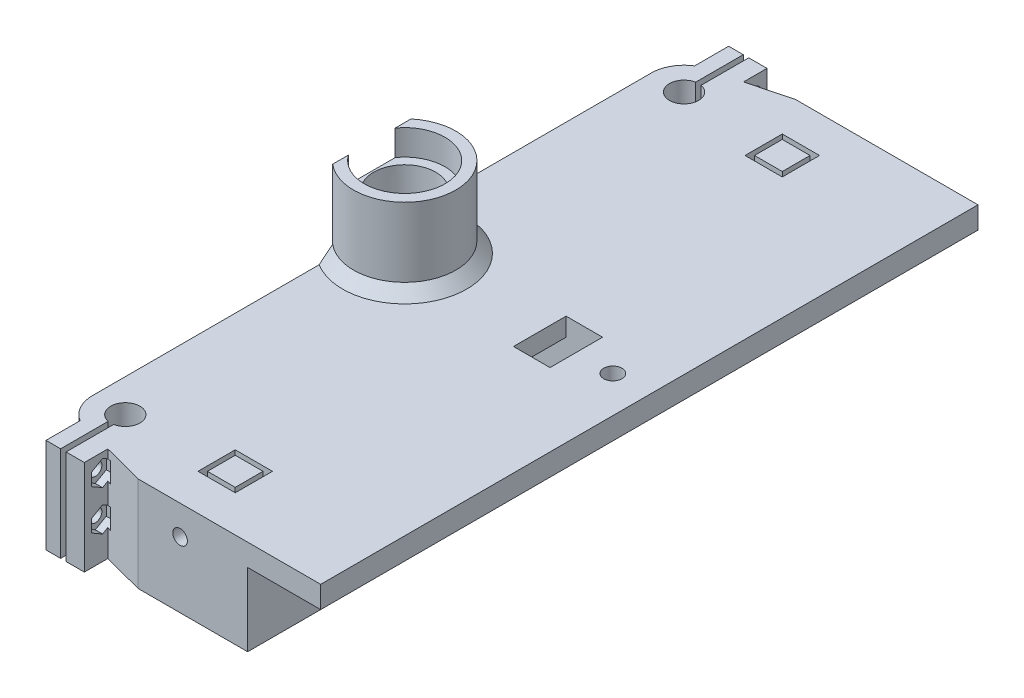
from build123d import *

# Parameters (mm, degrees)
SZKIC1_W                         = 20
SZKIC1_H                         = 6
DODANIE_WYCI_GNI_CIE1_DEPTH      = 180
SZKIC2_R                         = 4
DODANIE_WYCI_GNI_CIE2_DEPTH      = 26
WYTNIJ_WYCI_GNI_CIE5_START       = -21
WYTNIJ_WYCI_GNI_CIE5_OUTLINE_R   = 4
WYTNIJ_WYCI_GNI_CIE5_DEPTH       = 21
SZKIC8_W                         = 13
SZKIC8_H                         = 9
SZKIC8_R                         = 2
WYTNIJ_WYCI_GNI_CIE6_DEPTH       = 4
DODANIE_WYCI_GNI_CIE4_START      = 22
SZKIC9_R                         = 14
SZKIC9_R_2                       = 4
DODANIE_WYCI_GNI_CIE4_DEPTH      = 22
SZKIC10_R                        = 11.05
SZKIC10_R_2                      = 4
WYTNIJ_WYCI_GNI_CIE7_DEPTH       = 7
SZKIC11_R                        = 8
SZKIC11_R_2                      = 4
WYTNIJ_WYCI_GNI_CIE8_DEPTH       = 15
SFAZOWANIE1_SIZE                 = 0.5
SFAZOWANIE1_SIZE2                = 12
WYTNIJ_WYCI_GNI_CIE9_START       = 22
WYTNIJ_WYCI_GNI_CIE9_DEPTH       = 22
WYTNIJ_WYCI_GNI_CIE10_START      = -3
SZKIC13_R                        = 4
WYTNIJ_WYCI_GNI_CIE10_DEPTH      = 3
SZKIC14_R                        = 2
WYTNIJ_WYCI_GNI_CIE11_DEPTH      = 8
WYTNIJ_WYCI_GNI_CIE12_START      = -26
SZKIC15_R                        = 2.8
WYTNIJ_WYCI_GNI_CIE12_DEPTH      = 10
SFAZOWANIE2_SIZE                 = 3
SZKIC16_W                        = 10.2
SZKIC16_H                        = 10.2
SZKIC16_W_2                      = 7.6
SZKIC16_H_2                      = 7.6
WYTNIJ_WYCI_GNI_CIE13_DEPTH      = 17
WYTNIJ_WYCI_GNI_CIE14_DEPTH      = 10
WYTNIJ_WYCI_GNI_CIE14_DEPTH_BACK = 8
SZKIC17_R                        = 2.5
SZKIC17_W                        = 10
SZKIC17_H                        = 14.4
WYTNIJ_WYCI_GNI_CIE15_DEPTH      = 194.473512399
DODANIE_WYCI_GNI_CIE5_DEPTH      = 26
WYTNIJ_WYCI_GNI_CIE16_REACH      = 197.51
SZKIC20_R                        = 1.8
WYTNIJ_WYCI_GNI_CIE17_START      = -11.5
WYTNIJ_WYCI_GNI_CIE17_DEPTH      = 3
DODANIE_WYCI_GNI_CIE6_START      = -2
DODANIE_WYCI_GNI_CIE6_DEPTH      = 2
SZKIC23_R                        = 2
WYTNIJ_WYCI_GNI_CIE18_DEPTH      = 10


# Read off the part's stored shape, not the designer's step: Wytnij-wyciągnięcie5
with BuildPart() as part:
    # Szkic1 → Dodanie-wyciągnięcie1 (new body)
    with BuildSketch(Plane.XY):
        Polygon((-10, -26), (-10, -6), (-10, 0), (-40, 0), (-40, -26), align=None)
        with Locations((0, -3)):
            Rectangle(SZKIC1_W, SZKIC1_H)
    extrude(amount=DODANIE_WYCI_GNI_CIE1_DEPTH)

    # Szkic2 → Dodanie-wyciągnięcie2 (add)
    with BuildSketch(Plane(origin=(0, 0, 0), x_dir=(1, 0, 0), z_dir=(0, 1, 0))):
        with BuildLine():
            Line((-40, -180), (-40, 0))
            Line((-40, 0), (-57, -4.5))
            ThreePointArc((-57, -4.5), (-63.363961031, -7.136038969), (-66, -13.5))
            Line((-66, -13.5), (-66, -166.5))
            ThreePointArc((-66, -166.5), (-63.363961031, -172.863961031), (-57, -175.5))
            Line((-57, -175.5), (-40, -180))
        make_face()
        with Locations(Location((-57, -90, 0), (0, 0, 180))):
            Circle(SZKIC2_R, mode=Mode.SUBTRACT)
        with Locations(Location((-57, -13.5, 0), (0, 0, 180))):
            Circle(SZKIC2_R, mode=Mode.SUBTRACT)
        with Locations(Location((-57, -166.5, 0), (0, 0, 180))):
            Circle(SZKIC2_R, mode=Mode.SUBTRACT)
    extrude(amount=-DODANIE_WYCI_GNI_CIE2_DEPTH)

    # Wytnij-wyciągnięcie5 outline → Wytnij-wyciągnięcie5 (cut)
    with BuildSketch(Plane.XZ.offset(26).offset(WYTNIJ_WYCI_GNI_CIE5_START)):
        with BuildLine():
            ThreePointArc((-63, 85.8), (-62.121320344, 83.678679656), (-60, 82.8))
            Line((-60, 82.8), (-57.7, 82.8))
            ThreePointArc((-57.7, 82.8), (-51.7, 76.8), (-45.7, 82.8))
            Line((-45.7, 82.8), (-10, 82.8))
            Line((-10, 82.8), (-10, 97.2))
            Line((-10, 97.2), (-45.7, 97.2))
            ThreePointArc((-45.7, 97.2), (-51.7, 103.2), (-57.7, 97.2))
            Line((-57.7, 97.2), (-60, 97.2))
            ThreePointArc((-60, 97.2), (-62.121320344, 96.321320344), (-63, 94.2))
            Line((-63, 94.2), (-63, 85.8))
        make_face()
        with Locations((-57, 90)):
            Circle(WYTNIJ_WYCI_GNI_CIE5_OUTLINE_R, mode=Mode.SUBTRACT)
    extrude(amount=WYTNIJ_WYCI_GNI_CIE5_DEPTH, mode=Mode.SUBTRACT)

    # Szkic8 → Wytnij-wyciągnięcie6 (cut)
    with BuildSketch(Plane.XZ.offset(5)):
        with Locations((-41.7, 90)):
            Rectangle(SZKIC8_W, SZKIC8_H)
        with Locations(Location((-51.7, 97.2, 0), (0, 0, 270))):
            Circle(SZKIC8_R)
        with Locations(Location((-51.7, 82.8, 0), (0, 0, 270))):
            Circle(SZKIC8_R)
    extrude(amount=-WYTNIJ_WYCI_GNI_CIE6_DEPTH, mode=Mode.SUBTRACT)

    # Szkic9 → Dodanie-wyciągnięcie4 (add)
    with BuildSketch(Plane(origin=(0, 0, 0), x_dir=(1, 0, 0), z_dir=(0, 1, 0)).offset(DODANIE_WYCI_GNI_CIE4_START)):
        with Locations(Location((-57, -90, 0), (0, 0, 229.994799115))):
            Circle(SZKIC9_R)
        with Locations(Location((-57, -90, 0), (0, 0, 180))):
            Circle(SZKIC9_R_2, mode=Mode.SUBTRACT)
    extrude(amount=-DODANIE_WYCI_GNI_CIE4_DEPTH)

    # Szkic10 → Wytnij-wyciągnięcie7 (cut)
    with BuildSketch(Plane(origin=(0, 22, 0), x_dir=(1, 0, 0), z_dir=(0, 1, 0))):
        with Locations(Location((-57, -90, 0), (0, 0, 180))):
            Circle(SZKIC10_R)
        with Locations(Location((-57, -90, 0), (0, 0, 180))):
            Circle(SZKIC10_R_2, mode=Mode.SUBTRACT)
    extrude(amount=-WYTNIJ_WYCI_GNI_CIE7_DEPTH, mode=Mode.SUBTRACT)

    # Szkic11 → Wytnij-wyciągnięcie8 (cut)
    with BuildSketch(Plane(origin=(0, 15, 0), x_dir=(1, 0, 0), z_dir=(0, 1, 0))):
        with Locations(Location((-57, -90, 0), (0, 0, 180))):
            Circle(SZKIC11_R)
        with Locations(Location((-57, -90, 0), (0, 0, 180))):
            Circle(SZKIC11_R_2, mode=Mode.SUBTRACT)
    extrude(amount=-WYTNIJ_WYCI_GNI_CIE8_DEPTH, mode=Mode.SUBTRACT)

    # Sfazowanie1
    sfazowanie1_edges = [part.edges().sort_by_distance(p)[0] for p in [
        (-49, 15, 90),
    ]]
    sfazowanie1_side = [part.faces().sort_by_distance(p)[0] for p in [
        (-46.262541197, 15, 90),
    ]]
    chamfer(sfazowanie1_edges, length=SFAZOWANIE1_SIZE, length2=SFAZOWANIE1_SIZE2, reference=sfazowanie1_side[0])

    # Szkic12 → Wytnij-wyciągnięcie9 (cut)
    with BuildSketch(Plane(origin=(0, 0, 0), x_dir=(1, 0, 0), z_dir=(0, 1, 0)).offset(WYTNIJ_WYCI_GNI_CIE9_START)):
        with BuildLine():
            Line((-66, -100.723805295), (-66, -79.276194705))
            ThreePointArc((-66, -79.276194705), (-71, -90), (-66, -100.723805295))
        make_face()
    extrude(amount=-WYTNIJ_WYCI_GNI_CIE9_DEPTH, mode=Mode.SUBTRACT)

    # Szkic13 → Wytnij-wyciągnięcie10 (cut)
    with BuildSketch(Plane.XZ.offset(26).offset(WYTNIJ_WYCI_GNI_CIE10_START)):
        with BuildLine():
            Line((-60, 104.2), (-30, 104.2))
            ThreePointArc((-30, 104.2), (-26.464466094, 102.735533906), (-25, 99.2))
            Line((-25, 99.2), (-25, 80.8))
            ThreePointArc((-25, 80.8), (-26.464466094, 77.264466094), (-30, 75.8))
            Line((-30, 75.8), (-60, 75.8))
            ThreePointArc((-60, 75.8), (-63.535533906, 77.264466094), (-65, 80.8))
            Line((-65, 80.8), (-65, 99.2))
            ThreePointArc((-65, 99.2), (-63.535533906, 102.735533906), (-60, 104.2))
        make_face()
        with Locations(Location((-57, 90, 0), (0, 0, 180))):
            Circle(SZKIC13_R, mode=Mode.SUBTRACT)
    extrude(amount=WYTNIJ_WYCI_GNI_CIE10_DEPTH, mode=Mode.SUBTRACT)

    # Szkic14 → Wytnij-wyciągnięcie11 (cut)
    with BuildSketch(Plane.XZ.offset(23)):
        with Locations(Location((-60, 101.2, 0), (0, 0, 270))):
            Circle(SZKIC14_R)
        with Locations(Location((-30, 101.2, 0), (0, 0, 270))):
            Circle(SZKIC14_R)
        with Locations(Location((-30, 78.8, 0), (0, 0, 270))):
            Circle(SZKIC14_R)
        with Locations(Location((-60, 78.8, 0), (0, 0, 270))):
            Circle(SZKIC14_R)
    extrude(amount=-WYTNIJ_WYCI_GNI_CIE11_DEPTH, mode=Mode.SUBTRACT)

    # Szkic15 → Wytnij-wyciągnięcie12 (cut)
    with BuildSketch(Plane(origin=(0, 0, 0), x_dir=(1, 0, 0), z_dir=(0, 1, 0)).offset(WYTNIJ_WYCI_GNI_CIE12_START)):
        with Locations((-15, -160)):
            Circle(SZKIC15_R)
        with Locations((-20, -103)):
            Circle(SZKIC15_R)
        with Locations((-15, -20)):
            Circle(SZKIC15_R)
        with Locations((-20, -77)):
            Circle(SZKIC15_R)
        Polygon((10, 0), (-10, 0), (-10, -82.8), (-10, -97.2), (-10, -180), (10, -180), align=None)
    extrude(amount=WYTNIJ_WYCI_GNI_CIE12_DEPTH, mode=Mode.SUBTRACT)

    # Sfazowanie2
    sfazowanie2_edges = [part.edges().sort_by_distance(p)[0] for p in [
        (-43, 0, 90),
    ]]
    chamfer(sfazowanie2_edges, length=SFAZOWANIE2_SIZE)

    # Szkic16 → Wytnij-wyciągnięcie13 (cut)
    with BuildSketch(Plane(origin=(0, 0, 0), x_dir=(1, 0, 0), z_dir=(0, 1, 0))):
        with Locations((-28.5, -164.9)):
            Rectangle(SZKIC16_W, SZKIC16_H)
        with Locations((-28.5, -164.9)):
            Rectangle(SZKIC16_W_2, SZKIC16_H_2, mode=Mode.SUBTRACT)
    wytnij_wyci_gni_cie13 = extrude(amount=-WYTNIJ_WYCI_GNI_CIE13_DEPTH, mode=Mode.SUBTRACT)

    # Lustro2: Wytnij-wyciągnięcie13 across plane
    add(wytnij_wyci_gni_cie13.mirror(Plane(origin=(0, 0, 90), x_dir=(1, 0, 0), z_dir=(0, 0, -1))), mode=Mode.SUBTRACT)

    # Szkic17 → Wytnij-wyciągnięcie14 (cut, two sides: drawn at the far end of the back side and taken through both)
    with BuildSketch(Plane.XZ.offset(5).offset(-WYTNIJ_WYCI_GNI_CIE14_DEPTH_BACK)):
        with Locations(Location((0, 90, 0), (0, 0, 90))):
            Circle(SZKIC17_R)
        with Locations((-15, 90)):
            Rectangle(SZKIC17_W, SZKIC17_H)
    extrude(amount=WYTNIJ_WYCI_GNI_CIE14_DEPTH + WYTNIJ_WYCI_GNI_CIE14_DEPTH_BACK, mode=Mode.SUBTRACT)

    # Szkic18 → Wytnij-wyciągnięcie15 (cut, through all)
    with BuildSketch(Plane(origin=(0, 0, 0), x_dir=(1, 0, 0), z_dir=(0, 1, 0))):
        with BuildLine():
            Line((-57.75, -4.531304443), (-57.75, -9.570941589))
            ThreePointArc((-57.75, -9.570941589), (-57, -9.5), (-56.25, -9.570941589))
            Line((-56.25, -9.570941589), (-56.25, -4.301470588))
            Line((-56.25, -4.301470588), (-57, -4.5))
            ThreePointArc((-57, -4.5), (-57.375326514, -4.507829516), (-57.75, -4.531304443))
        make_face()
    wytnij_wyci_gni_cie15 = extrude(amount=-WYTNIJ_WYCI_GNI_CIE15_DEPTH, mode=Mode.SUBTRACT)

    # Szkic19 → Dodanie-wyciągnięcie5 (add)
    with BuildSketch(Plane(origin=(0, 0, 0), x_dir=(1, 0, 0), z_dir=(0, 1, 0))):
        with BuildLine():
            ThreePointArc((-61.75, -5.855557574), (-59.828588268, -4.956049602), (-57.75, -4.531304443))
            Line((-57.75, -4.531304443), (-57.75, 3.468695557))
            Line((-57.75, 3.468695557), (-61.75, 3.468695557))
            Line((-61.75, 3.468695557), (-61.75, -5.855557574))
        make_face()
        Polygon((-56.25, -4.301470588), (-51.25, -2.977941176), (-51.25, 3.468695557), (-56.25, 3.468695557), align=None)
    dodanie_wyci_gni_cie5 = extrude(amount=-DODANIE_WYCI_GNI_CIE5_DEPTH)

    # Wytnij-wyciągnięcie16: up to this face of the body (flat: up to its plane)
    wytnij_wyci_gni_cie16_end = Plane(part.part.faces().sort_by_distance((-51.25, -13, -0.24537719))[0])
    # Szkic20 → Wytnij-wyciągnięcie16 (cut, up to the picked face)
    with BuildSketch(Plane.ZY.offset(61.75), mode=Mode.PRIVATE) as wytnij_wyci_gni_cie16_sk1:
        with Locations(Location((1.531304443, -5, 0), (0, 0, 323.483648639))):
            Circle(SZKIC20_R)
    wytnij_wyci_gni_cie16_tool1 = split(extrude(wytnij_wyci_gni_cie16_sk1.sketch, amount=-WYTNIJ_WYCI_GNI_CIE16_REACH, mode=Mode.PRIVATE), bisect_by=wytnij_wyci_gni_cie16_end, keep=Keep.BOTH, mode=Mode.PRIVATE)
    # Szkic20 → Wytnij-wyciągnięcie16 (cut, up to the picked face)
    with BuildSketch(Plane.ZY.offset(61.75), mode=Mode.PRIVATE) as wytnij_wyci_gni_cie16_sk2:
        with Locations(Location((1.531304443, -16, 0), (0, 0, 323.483648639))):
            Circle(SZKIC20_R)
    wytnij_wyci_gni_cie16_tool2 = split(extrude(wytnij_wyci_gni_cie16_sk2.sketch, amount=-WYTNIJ_WYCI_GNI_CIE16_REACH, mode=Mode.PRIVATE), bisect_by=wytnij_wyci_gni_cie16_end, keep=Keep.BOTH, mode=Mode.PRIVATE)
    wytnij_wyci_gni_cie16_1 = wytnij_wyci_gni_cie16_tool1.solids().sort_by(Axis((-61.75, -5, 1.531304), (1, 0, 0)))[0]
    add(wytnij_wyci_gni_cie16_1, mode=Mode.SUBTRACT)
    wytnij_wyci_gni_cie16_2 = wytnij_wyci_gni_cie16_tool2.solids().sort_by(Axis((-61.75, -16, 1.531304), (1, 0, 0)))[0]
    add(wytnij_wyci_gni_cie16_2, mode=Mode.SUBTRACT)
    wytnij_wyci_gni_cie16 = wytnij_wyci_gni_cie16_1 + wytnij_wyci_gni_cie16_2  # Wytnij-wyciągnięcie16 as one shape, for the pattern or mirror that repeats it

    # Szkic21 → Wytnij-wyciągnięcie17 (cut)
    with BuildSketch(Plane.ZY.offset(61.75).offset(WYTNIJ_WYCI_GNI_CIE17_START)):
        Polygon((1.531304443, -1.535898385), (-1.468695557, -3.267949192), (-1.468695557, -6.732050808), (1.531304443, -8.464101615), (4.531304443, -6.732050808), (4.531304443, -3.267949192), align=None)
        Polygon((1.531304443, -12.535898385), (-1.468695557, -14.267949192), (-1.468695557, -17.732050808), (1.531304443, -19.464101615), (4.531304443, -17.732050808), (4.531304443, -14.267949192), align=None)
    wytnij_wyci_gni_cie17 = extrude(amount=WYTNIJ_WYCI_GNI_CIE17_DEPTH, mode=Mode.SUBTRACT)

    # Szkic22 → Dodanie-wyciągnięcie6 (add)
    with BuildSketch(Plane.XZ.offset(26).offset(DODANIE_WYCI_GNI_CIE6_START)):
        with BuildLine():
            ThreePointArc((-53, 13.5), (-57, 17.5), (-61, 13.5))
            Line((-61, 13.5), (-53, 13.5))
        make_face()
    dodanie_wyci_gni_cie6 = extrude(amount=DODANIE_WYCI_GNI_CIE6_DEPTH)

    # Szkic23 → Wytnij-wyciągnięcie18 (cut)
    with BuildSketch(Plane.XY.offset(180)):
        with Locations((-28.5, -8)):
            Circle(SZKIC23_R)
    wytnij_wyci_gni_cie18 = extrude(amount=-WYTNIJ_WYCI_GNI_CIE18_DEPTH, mode=Mode.SUBTRACT)

    # Lustro3: Wytnij-wyciągnięcie15, Dodanie-wyciągnięcie5, Wytnij-wyciągnięcie16, Wytnij-wyciągnięcie17, Dodanie-wyciągnięcie6, Wytnij-wyciągnięcie18 across plane
    add(wytnij_wyci_gni_cie15.mirror(Plane(origin=(0, 0, 90), x_dir=(1, 0, 0), z_dir=(0, 0, -1))), mode=Mode.SUBTRACT)
    add(dodanie_wyci_gni_cie5.mirror(Plane(origin=(0, 0, 90), x_dir=(1, 0, 0), z_dir=(0, 0, -1))))
    add(wytnij_wyci_gni_cie16.mirror(Plane(origin=(0, 0, 90), x_dir=(1, 0, 0), z_dir=(0, 0, -1))), mode=Mode.SUBTRACT)
    add(wytnij_wyci_gni_cie17.mirror(Plane(origin=(0, 0, 90), x_dir=(1, 0, 0), z_dir=(0, 0, -1))), mode=Mode.SUBTRACT)
    add(dodanie_wyci_gni_cie6.mirror(Plane(origin=(0, 0, 90), x_dir=(1, 0, 0), z_dir=(0, 0, -1))))
    add(wytnij_wyci_gni_cie18.mirror(Plane(origin=(0, 0, 90), x_dir=(1, 0, 0), z_dir=(0, 0, -1))), mode=Mode.SUBTRACT)


solid = part.part
